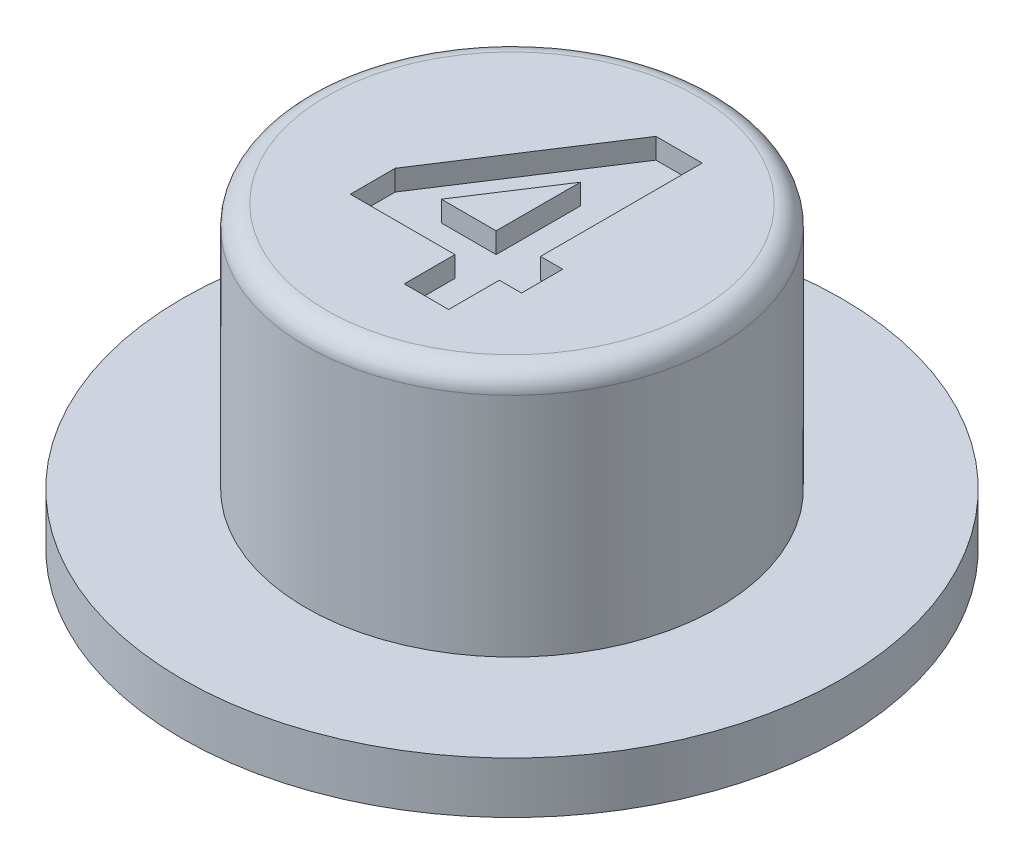
from build123d import *

# Parameters (mm, degrees)
SKETCH2_W          = 3.5
SKETCH2_H          = 2.5
CUT_EXTRUDE1_DEPTH = 3.5
FILLET1_R          = 0.5
CUT_EXTRUDE2_DEPTH = 0.5


with BuildPart() as part:
    # Sketch1 → Revolve1 (revolve)
    with BuildSketch(Plane.XY):
        Polygon((0, 7.25), (5, 7.25), (5, 1.25), (8, 1.25), (8, 0), (0, 0), align=None)
    revolve(axis=Axis((0, 7.25, 0), (0, -1, 0)))

    # Sketch2 → Cut-Extrude1 (cut)
    with BuildSketch(Plane.XZ):
        Rectangle(SKETCH2_W, SKETCH2_H)
    extrude(amount=-CUT_EXTRUDE1_DEPTH, mode=Mode.SUBTRACT)

    # Fillet1
    fillet1_edges = [part.edges().sort_by_distance(p)[0] for p in [
        (-5, 7.25, 0),
    ]]
    fillet(fillet1_edges, radius=FILLET1_R)

    # Sketch3 → Cut-Extrude2 (cut)
    with BuildSketch(Plane(origin=(0, 7.25, 0), x_dir=(1, 0, 0), z_dir=(0, 1, 0))):
        Polygon((0.338942308, 3.153846154), (1.461538462, 3.153846154), (1.461538462, -0.769230769), (2, -0.769230769), (2, -1.769230769), (1.461538462, -1.769230769), (1.461538462, -3), (0.384615385, -3), (0.384615385, -1.769230769), (-2.153846154, -1.769230769), (-2.153846154, -0.679086538), align=None)
        Polygon((0.384615385, -0.769230769), (0.384615385, 1.272836538), (-0.943509615, -0.769230769), align=None, mode=Mode.SUBTRACT)
    extrude(amount=-CUT_EXTRUDE2_DEPTH, mode=Mode.SUBTRACT)


solid = part.part
